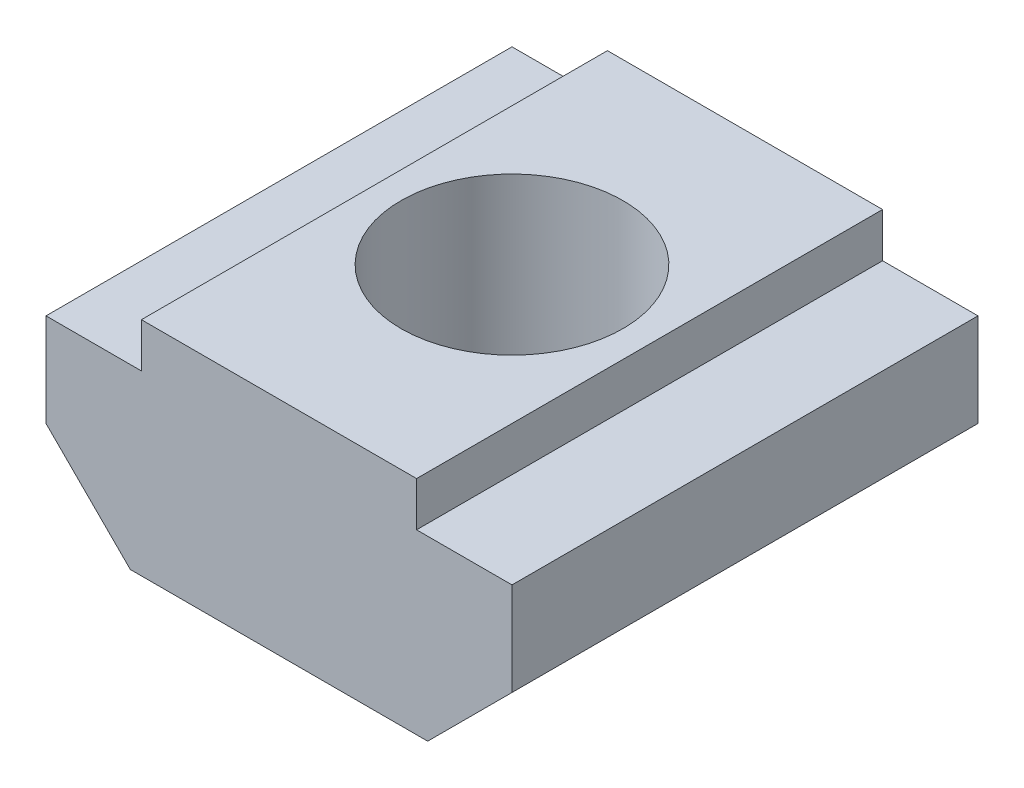
from build123d import *

# Parameters (mm, degrees)
BOSS_EXTRUDE1_DEPTH = 10.5
SKETCH3_R           = 2.5
CUT_EXTRUDE1_DEPTH  = 13.759800155


with BuildPart() as part:
    # Sketch2 → Boss-Extrude1 (new body)
    with BuildSketch(Plane.XY):
        Polygon((-3.1, 1.5), (-5.25, 1.5), (-5.25, -0.6), (-3.35, -2.5), (3.35, -2.5), (5.25, -0.6), (5.25, 1.5), (3.1, 1.5), (3.1, 2.5), (-3.1, 2.5), align=None)
    extrude(amount=BOSS_EXTRUDE1_DEPTH)

    # Sketch3 → Cut-Extrude1 (cut, through all)
    with BuildSketch(Plane(origin=(0, 2.5, 0), x_dir=(1, 0, 0), z_dir=(0, 1, 0))):
        with Locations((0, -5.25)):
            Circle(SKETCH3_R)
    extrude(amount=-CUT_EXTRUDE1_DEPTH, mode=Mode.SUBTRACT)


solid = part.part
